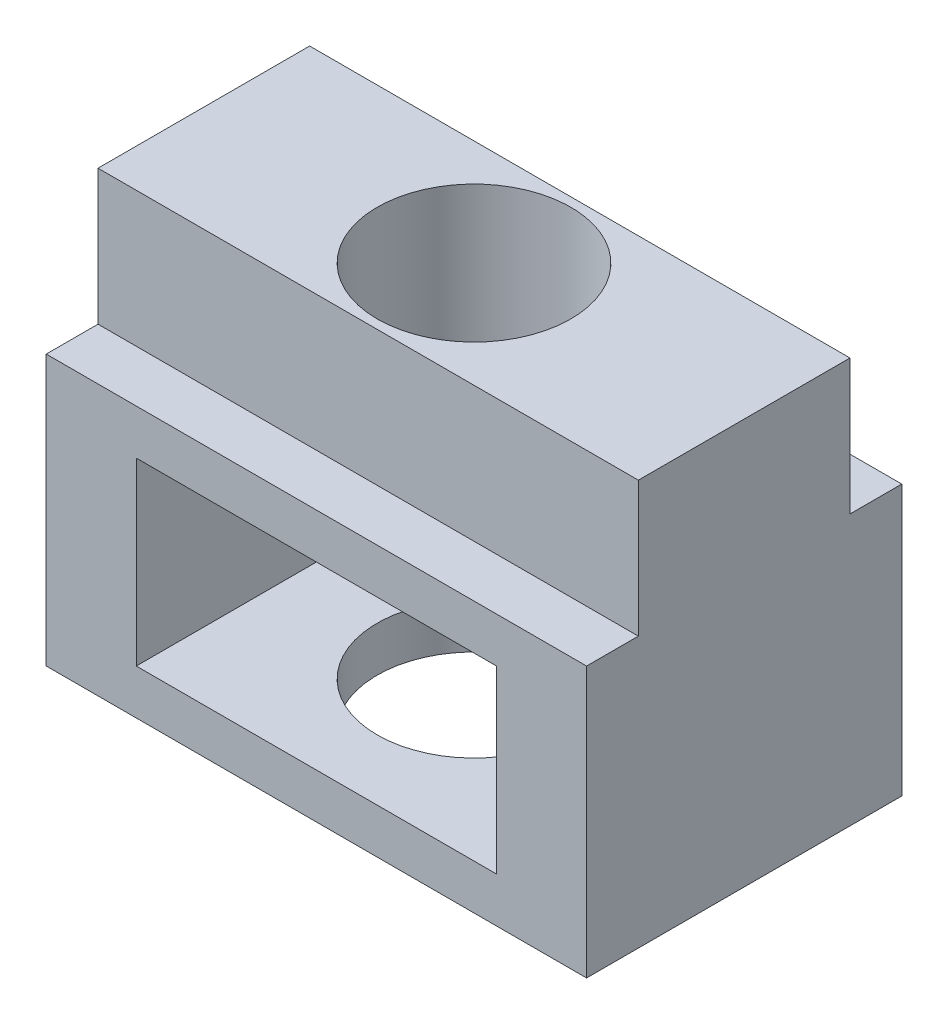
from build123d import *

# Parameters (mm, degrees)
SKETCH1_W           = 12
SKETCH1_H           = 7
BOSS_EXTRUDE1_DEPTH = 6
SKETCH2_W           = 12
SKETCH2_H           = 4.7
BOSS_EXTRUDE2_DEPTH = 3
SKETCH3_W           = 8
SKETCH3_H           = 4
CUT_EXTRUDE1_DEPTH  = 13.884098727
SKETCH4_R           = 2.15
CUT_EXTRUDE2_DEPTH  = 12.368817001


with BuildPart() as part:
    # Sketch1 → Boss-Extrude1 (new body)
    with BuildSketch(Plane(origin=(0, 0, 0), x_dir=(1, 0, 0), z_dir=(0, 1, 0))):
        Rectangle(SKETCH1_W, SKETCH1_H)
    extrude(amount=BOSS_EXTRUDE1_DEPTH)

    # Sketch2 → Boss-Extrude2 (add)
    with BuildSketch(Plane(origin=(0, 6, 0), x_dir=(1, 0, 0), z_dir=(0, 1, 0))):
        Rectangle(SKETCH2_W, SKETCH2_H)
    extrude(amount=BOSS_EXTRUDE2_DEPTH)

    # Sketch3 → Cut-Extrude1 (cut, through all)
    with BuildSketch(Plane.XY.offset(3.5)):
        with Locations((0, 3)):
            Rectangle(SKETCH3_W, SKETCH3_H)
    extrude(amount=-CUT_EXTRUDE1_DEPTH, mode=Mode.SUBTRACT)

    # Sketch4 → Cut-Extrude2 (cut, through all)
    with BuildSketch(Plane(origin=(0, 9, 0), x_dir=(1, 0, 0), z_dir=(0, 1, 0))):
        Circle(SKETCH4_R)
    extrude(amount=-CUT_EXTRUDE2_DEPTH, mode=Mode.SUBTRACT)


solid = part.part
